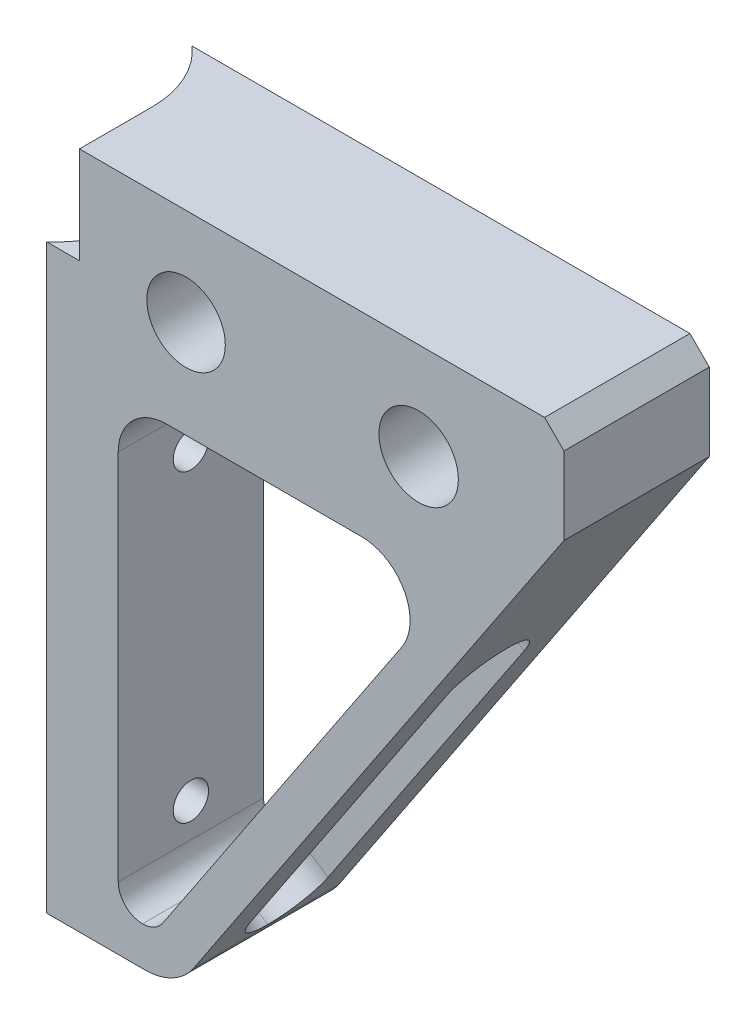
from build123d import *

# Parameters (mm, degrees)
P_IDAT_VYSUNUT_M1_DEPTH  = 15
SKICA2_R                 = 4.1
ODEBRAT_VYSUNUT_M1_DEPTH = 88.321245983
SKICA3_R                 = 4.05
ODEBRAT_VYSUNUT_M2_DEPTH = 10
ODEBRAT_VYSUNUT_M3_DEPTH = 88.321245983
P_IDAT_VYSUNUT_M2_DEPTH  = 70
SKICA6_W                 = 3.385621722
SKICA6_H                 = 7.5
ODEBRAT_VYSUNUT_M4_DEPTH = 10
SKICA8_W                 = 8
SKICA8_H                 = 44.48438966
ODEBRAT_VYSUNUT_M5_DEPTH = 88.290898193
ZAOBLIT1_R               = 4
SKICA9_R                 = 1.825
ODEBRAT_VYSUNUT_M6_DEPTH = 86.094065598
ZAOBLIT3_R               = 6
ZKOSEN_1_SIZE            = 2


with BuildPart() as part:
    # Skica1 → Přidat vysunutím1 (new body)
    with BuildSketch(Plane.XY):
        Polygon((0, 0), (10, 0), (50, 60), (50, 70), (0, 70), align=None)
    extrude(amount=P_IDAT_VYSUNUT_M1_DEPTH)

    # Skica2 → Odebrat vysunutím1 (cut, through all)
    with BuildSketch(Plane.XY.offset(15)):
        with Locations((35, 60)):
            Circle(SKICA2_R)
    extrude(amount=-ODEBRAT_VYSUNUT_M1_DEPTH, mode=Mode.SUBTRACT)

    # Skica3 → Odebrat vysunutím2 (cut)
    with BuildSketch(Plane.XY.offset(15)):
        with Locations((11, 60)):
            Circle(SKICA3_R)
    extrude(amount=-ODEBRAT_VYSUNUT_M2_DEPTH, mode=Mode.SUBTRACT)

    # Skica4 → Odebrat vysunutím3 (cut, through all)
    with BuildSketch(Plane.XY.offset(15)):
        with BuildLine():
            Line((9, 49.9), (29.116679507, 49.9))
            ThreePointArc((29.116679507, 49.9), (33.525052501, 47.259289628), (33.276930979, 42.126499019))
            Line((33.276930979, 42.126499019), (8.601431306, 5.113249509))
            ThreePointArc((8.601431306, 5.113249509), (7.700950384, 4.295813503), (6.52130557, 4))
            Line((6.52130557, 4), (6.5, 4))
            ThreePointArc((6.5, 4), (4.732233047, 4.732233047), (4, 6.5))
            Line((4, 6.5), (4, 44.9))
            ThreePointArc((4, 44.9), (5.464466094, 48.435533906), (9, 49.9))
        make_face()
    extrude(amount=-ODEBRAT_VYSUNUT_M3_DEPTH, mode=Mode.SUBTRACT)

    # Skica5 → Přidat vysunutím2 (add)
    with BuildSketch(Plane(origin=(0, 70, 0), x_dir=(1, 0, 0), z_dir=(0, 1, 0))):
        with BuildLine():
            Line((-3.385621722, 0), (3, 0))
            Line((3, 0), (3, -15))
            Line((3, -15), (-3.385621722, -15))
            ThreePointArc((-3.385621722, -15), (0, -7.5), (-3.385621722, 0))
        make_face()
    extrude(amount=-P_IDAT_VYSUNUT_M2_DEPTH)

    # Skica6 → Odebrat vysunutím4 (cut)
    with BuildSketch(Plane(origin=(0, 70, 0), x_dir=(1, 0, 0), z_dir=(0, 1, 0))):
        with Locations((-1.692810861, -11.25)):
            Rectangle(SKICA6_W, SKICA6_H)
    extrude(amount=-ODEBRAT_VYSUNUT_M4_DEPTH, mode=Mode.SUBTRACT)

    # Skica8 → Odebrat vysunutím5 (cut, through all)
    with BuildSketch(Plane(origin=(3.594875746, -2.39658383, 0), x_dir=(0, 0, 1), z_dir=(-0.8320502943378438, 0.5547001962252291, 0))):
        with Locations((7.5, 31.267891222)):
            Rectangle(SKICA8_W, SKICA8_H)
    extrude(amount=-ODEBRAT_VYSUNUT_M5_DEPTH, mode=Mode.SUBTRACT)

    # Zaoblit1
    zaoblit1_edges = [part.edges().sort_by_distance(p)[0] for p in [
        (34.941031567, 41.017098626, 3.5),
        (34.941031567, 41.017098626, 11.5),
        (10.265531894, 4.003849117, 11.5),
        (10.265531894, 4.003849117, 3.5),
    ]]
    fillet(zaoblit1_edges, radius=ZAOBLIT1_R - 0.0001)  # a hair under: the kernel refuses the full size

    # Skica9 → Odebrat vysunutím6 (cut, through all)
    with BuildSketch(Plane(origin=(4, 0, 0), x_dir=(0, 0, -1), z_dir=(1, 0, 0))):
        with Locations(Location((-7.5, 10, 0), (0, 0, 90))):
            Circle(SKICA9_R)
        with Locations(Location((-7.5, 41.4, 0), (0, 0, 90))):
            Circle(SKICA9_R)
    extrude(amount=-ODEBRAT_VYSUNUT_M6_DEPTH, mode=Mode.SUBTRACT)

    # Zaoblit3
    zaoblit3_edges = [part.edges().sort_by_distance(p)[0] for p in [
        (10, 0, 7.5),
    ]]
    fillet(zaoblit3_edges, radius=ZAOBLIT3_R)

    # Zkosení1
    zkosen_1_edges = [part.edges().sort_by_distance(p)[0] for p in [
        (50, 70, 7.5),
    ]]
    chamfer(zkosen_1_edges, length=ZKOSEN_1_SIZE)


solid = part.part
